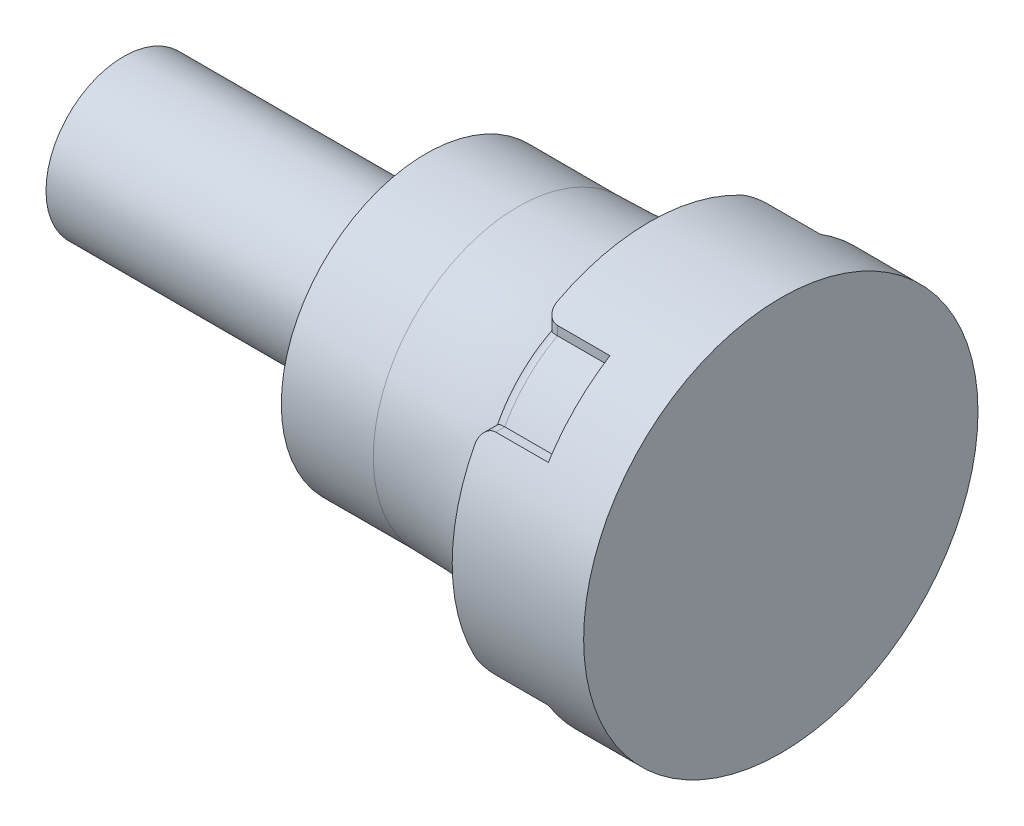
from build123d import *

# Parameters (mm, degrees)
BASPROSKE_W             = 10
BASPROSKE_H             = 134
TOOTHCUT_DEPTH          = 190.768279752
TEETHCUTS_COUNT         = 65
TEETHCUTS_ANGLE         = 354.461538462
HUBNEAONESKE_R          = 6
HUBNEARONE_DEPTH        = 40.0000508
BORSKE_R                = 4
BORE_DEPTH              = 50.0000508
ENL_V_MAT_EXTRU_1_DEPTH = 10
ENL_V_MAT_EXTRU_2_DEPTH = 5
CONG_1_R                = 10
CONG_2_R                = 2
ENL_V_MAT_EXTRU_3_DEPTH = 194.670907796
CONG_3_R                = 10
CONG_4_R                = 2
CONG_5_R                = 1
ESQUISSE5_R             = 11
ESQUISSE5_R_2           = 6
BOSS_EXTRU_1_DEPTH      = 17
CONG_6_SIZE             = 2
CONG_6_SIZE_2           = 10
BOSS_EXTRU_2_START      = -30
BOSS_EXTRU_2_DEPTH      = 30
BOSS_EXTRU_3_START      = 20.0000508
ESQUISSE7_R             = 4
BOSS_EXTRU_3_DEPTH      = 20.0000508
ENL_V_START             = -23
ESQUISSE8_R             = 6
ESQUISSE8_R_2           = 5.9
ENL_V_MAT_EXTRU_4_DEPTH = 23
ESQUISSE9_R             = 170.665852753
ESQUISSE9_R_2           = 15
ENL_V_MAT_EXTRU_8_DEPTH = 192.855196601


with BuildPart() as part:
    # BasProSke → Base-Revolve (revolve)
    with BuildSketch(Plane(origin=(0, 0, 0), x_dir=(1, 0, 0), z_dir=(0, 1, 0)), mode=Mode.PRIVATE) as base_revolve_sk:
        with Locations((5, 67)):
            Rectangle(BASPROSKE_W, BASPROSKE_H)
    revolve(base_revolve_sk.sketch.rotate(Axis((-10, 0, 0), (1, 0, 0)), 180), axis=Axis((-10, 0, 0), (1, 0, 0)))

    # TooCutSke → ToothCut (cut, through all)
    with BuildSketch(Plane(origin=(0, 0, 0), x_dir=(0, 0, -1), z_dir=(1, 0, 0))):
        with BuildLine():
            ThreePointArc((1.667679112, 124.987874801), (0, 124.999), (-1.667679112, 124.987874801))
            ThreePointArc((-1.667679112, 124.987874801), (-3.198590853, 129.537570146), (-5.142534786, 133.926704511))
            ThreePointArc((-5.142534786, 133.926704511), (0, 134.0254), (5.142534786, 133.926704511))
            ThreePointArc((5.142534786, 133.926704511), (3.198590853, 129.537570146), (1.667679112, 124.987874801))
        make_face()
    toothcut = extrude(amount=TOOTHCUT_DEPTH, mode=Mode.SUBTRACT)

    # TeethCuts: ToothCut ×65 about axis
    teethcuts_axis = Axis((-10, 0, 0), (1, 0, 0))
    for i in range(1, TEETHCUTS_COUNT):
        add(toothcut.rotate(teethcuts_axis, i * TEETHCUTS_ANGLE / (TEETHCUTS_COUNT - 1)), mode=Mode.SUBTRACT)

    # HubNeaOneSke → HubNearOne (add)
    with BuildSketch(Plane.ZY):
        with Locations(Location((0, 0, 0), (0, 0, 180))):
            Circle(HUBNEAONESKE_R)
    extrude(amount=HUBNEARONE_DEPTH)

    # BorSke → Bore (cut, symmetric)
    with BuildSketch(Plane(origin=(0, 0, 0), x_dir=(0, 0, -1), z_dir=(1, 0, 0))):
        with Locations(Location((0, 0, 0), (0, 0, 180))):
            Circle(BORSKE_R)
    extrude(amount=BORE_DEPTH, both=True, mode=Mode.SUBTRACT)

    # Esquisse1 → Enlèv. mat.-Extru.1 (cut)
    with BuildSketch(Plane(origin=(10, 0, 0), x_dir=(0, 0, -1), z_dir=(1, 0, 0))):
        with BuildLine():
            Line((3, 100), (3, 25))
            Line((3, 25), (-3, 25))
            Line((-3, 25), (-3, 100))
            ThreePointArc((-3, 100), (0, 103), (3, 100))
        make_face()
        with BuildLine():
            Line((-3, 25), (3, 25))
            ThreePointArc((3, 25), (0, 22), (-3, 25))
        make_face()
        with BuildLine():
            Line((100, 3), (25, 3))
            ThreePointArc((25, 3), (22, 0), (25, -3))
            Line((25, -3), (100, -3))
            ThreePointArc((100, -3), (103, 0), (100, 3))
        make_face()
        with BuildLine():
            Line((-100, -3), (-25, -3))
            ThreePointArc((-25, -3), (-22, 0), (-25, 3))
            Line((-25, 3), (-100, 3))
            ThreePointArc((-100, 3), (-103, 0), (-100, -3))
        make_face()
        with BuildLine():
            Line((3, -100), (3, -25))
            ThreePointArc((3, -25), (0, -22), (-3, -25))
            Line((-3, -25), (-3, -100))
            ThreePointArc((-3, -100), (0, -103), (3, -100))
        make_face()
    extrude(amount=-ENL_V_MAT_EXTRU_1_DEPTH, mode=Mode.SUBTRACT)

    # Esquisse3 → Enlèv. mat.-Extru.2 (cut)
    with BuildSketch(Plane.ZY):
        Polygon((-113, -8), (-113, -18), (-18, -18), (-18, -113), (-8, -113), (-8, -12), (-12, -12), (-12, -8), align=None)
        Polygon((-113, 8), (-12, 8), (-12, 12), (-8, 12), (-8, 113), (-18, 113), (-18, 18), (-113, 18), align=None)
        Polygon((8, 113), (8, 12), (12, 12), (12, 8), (113, 8), (113, 18), (18, 18), (18, 113), align=None)
        Polygon((113, -8), (12, -8), (12, -12), (8, -12), (8, -113), (18, -113), (18, -18), (113, -18), align=None)
    extrude(amount=-ENL_V_MAT_EXTRU_2_DEPTH, mode=Mode.SUBTRACT)

    # Congé1
    # the kernel refuses this fillet: 10 mm, written as the material it takes off along each edge
    with BuildSketch(Plane(origin=(-25, -18, -18), x_dir=(0, 0, -1), z_dir=(1, 0, 0)), Plane(origin=(-25, 18, -18), x_dir=(0, 1, 0), z_dir=(1, 0, 0)), Plane(origin=(-25, 18, 18), x_dir=(0, 0, 1), z_dir=(1, 0, 0)), Plane(origin=(-25, -18, 18), x_dir=(0, -1, 0), z_dir=(1, 0, 0))) as cong_1_piece_1:
        with BuildLine():
            CenterArc((CONG_1_R, -CONG_1_R), CONG_1_R, 90, 90)
            Line((0, -CONG_1_R), (0, 0))
            Line((0, 0), (CONG_1_R, 0))
        make_face()
    extrude(amount=30, mode=Mode.SUBTRACT)
    with BuildSketch(Plane(origin=(-10, -12, 12), x_dir=(0, 1, 0), z_dir=(1, 0, 0)), Plane(origin=(-10, -12, -12), x_dir=(0, 0, 1), z_dir=(1, 0, 0)), Plane(origin=(-10, 12, 12), x_dir=(0, 0, -1), z_dir=(1, 0, 0)), Plane(origin=(-10, 12, -12), x_dir=(0, -1, 0), z_dir=(1, 0, 0))) as cong_1_piece_2:
        with BuildLine():
            CenterArc((8.782329983, -8.782329983), CONG_1_R, 118.570059811, 32.859880379)
            Line((0, -4), (0, 0))
            Line((0, 0), (4, 0))
        make_face()
    extrude(amount=15, mode=Mode.SUBTRACT)

    # Congé2
    cong_2_edges = [part.edges().sort_by_distance(p)[0] for p in [
        (2.5, 18, 113),
        (2.5, 8, 113),
        (2.5, 113, 8),
        (2.5, 113, 18),
        (2.5, 8, -113),
        (2.5, 18, -113),
        (2.5, 113, -18),
        (2.5, 113, -8),
        (2.5, -8, -113),
        (2.5, -113, -8),
        (2.5, -113, -18),
        (2.5, -18, -113),
        (2.5, -113, 18),
        (2.5, -113, 8),
        (2.5, -8, 113),
        (2.5, -18, 113),
    ]]
    fillet(cong_2_edges, radius=CONG_2_R)

    # Esquisse4 → Enlèv. mat.-Extru.3 (cut, through all)
    with BuildSketch(Plane.ZY):
        with BuildLine():
            Line((-93.541434669, 35.355339059), (-35.355339059, 35.355339059))
            Line((-35.355339059, 35.355339059), (-35.355339059, 93.541434669))
            ThreePointArc((-35.355339059, 93.541434669), (-70.710678119, 70.710678119), (-93.541434669, 35.355339059))
        make_face()
        with BuildLine():
            Line((35.355339059, 93.541434669), (35.355339059, 35.355339059))
            Line((35.355339059, 35.355339059), (93.541434669, 35.355339059))
            ThreePointArc((93.541434669, 35.355339059), (70.710678119, 70.710678119), (35.355339059, 93.541434669))
        make_face()
        with BuildLine():
            Line((93.541434669, -35.355339059), (35.355339059, -35.355339059))
            Line((35.355339059, -35.355339059), (35.355339059, -93.541434669))
            ThreePointArc((35.355339059, -93.541434669), (70.710678119, -70.710678119), (93.541434669, -35.355339059))
        make_face()
        with BuildLine():
            Line((-35.355339059, -93.541434669), (-35.355339059, -35.355339059))
            Line((-35.355339059, -35.355339059), (-93.541434669, -35.355339059))
            ThreePointArc((-93.541434669, -35.355339059), (-70.710678119, -70.710678119), (-35.355339059, -93.541434669))
        make_face()
    extrude(amount=-ENL_V_MAT_EXTRU_3_DEPTH, mode=Mode.SUBTRACT)

    # Congé3
    cong_3_edges = [part.edges().sort_by_distance(p)[0] for p in [
        (5, 35.355339059, -35.355339059),
        (5, 35.355339059, 35.355339059),
        (5, -35.355339059, 35.355339059),
        (5, -35.355339059, -35.355339059),
    ]]
    fillet(cong_3_edges, radius=CONG_3_R)

    # Congé4
    cong_4_edges = [part.edges().sort_by_distance(p)[0] for p in [
        (5, 35.355339059, -93.541434669),
        (5, 93.541434669, -35.355339059),
        (5, 93.541434669, 35.355339059),
        (5, 35.355339059, 93.541434669),
        (5, -35.355339059, 93.541434669),
        (5, -93.541434669, 35.355339059),
        (5, -93.541434669, -35.355339059),
        (5, -35.355339059, -93.541434669),
    ]]
    fillet(cong_4_edges, radius=CONG_4_R)

    # Congé5
    # the kernel refuses this fillet: 1 mm, written as the material it takes off along each edge
    with BuildSketch(Plane(origin=(0, 8, 9.5), x_dir=(0, -1, 0), z_dir=(0, 0, 1))) as cong_5_piece_1_section:
        with BuildLine():
            CenterArc((CONG_5_R, CONG_5_R), CONG_5_R, 180, 90)
            Line((0, CONG_5_R), (0, 0))
            Line((0, 0), (CONG_5_R, 0))
        make_face()
    cong_5_piece_1 = extrude(amount=101.5, mode=Mode.PRIVATE)
    cong_5_piece_1 = cong_5_piece_1 - Plane(origin=(0, 3.217670017, 3.217670017), x_dir=(0, 0, -1), z_dir=(-1, 0, 0)) * Cylinder(10, 208, mode=Mode.PRIVATE)
    with BuildSketch(Plane(origin=(0, 9.5, -8), x_dir=(0, 0, 1), z_dir=(0, 1, 0))) as cong_5_piece_2_section:
        with BuildLine():
            CenterArc((CONG_5_R, CONG_5_R), CONG_5_R, 180, 90)
            Line((0, CONG_5_R), (0, 0))
            Line((0, 0), (CONG_5_R, 0))
        make_face()
    cong_5_piece_2 = extrude(amount=101.5, mode=Mode.PRIVATE)
    cong_5_piece_2 = cong_5_piece_2 - Plane(origin=(0, 3.217670017, -3.217670017), x_dir=(0, -1, 0), z_dir=(-1, 0, 0)) * Cylinder(10, 207, mode=Mode.PRIVATE)
    with BuildSketch(Plane(origin=(0, -8, -9.5), x_dir=(0, 1, 0), z_dir=(0, 0, -1))) as cong_5_piece_3_section:
        with BuildLine():
            CenterArc((CONG_5_R, CONG_5_R), CONG_5_R, 180, 90)
            Line((0, CONG_5_R), (0, 0))
            Line((0, 0), (CONG_5_R, 0))
        make_face()
    cong_5_piece_3 = extrude(amount=101.5, mode=Mode.PRIVATE)
    cong_5_piece_3 = cong_5_piece_3 - Plane(origin=(0, -3.217670017, -3.217670017), x_dir=(0, 0, 1), z_dir=(-1, 0, 0)) * Cylinder(10, 207, mode=Mode.PRIVATE)
    with BuildSketch(Plane(origin=(0, -9.5, 8), x_dir=(0, 0, -1), z_dir=(0, -1, 0))) as cong_5_piece_4_section:
        with BuildLine():
            CenterArc((CONG_5_R, CONG_5_R), CONG_5_R, 180, 90)
            Line((0, CONG_5_R), (0, 0))
            Line((0, 0), (CONG_5_R, 0))
        make_face()
    cong_5_piece_4 = extrude(amount=101.5, mode=Mode.PRIVATE)
    cong_5_piece_4 = cong_5_piece_4 - Plane(origin=(0, -3.217670017, 3.217670017), x_dir=(0, 1, 0), z_dir=(-1, 0, 0)) * Cylinder(10, 207, mode=Mode.PRIVATE)
    with BuildSketch(Plane(origin=(0, -28, -18), x_dir=(0, 0, -1), z_dir=(0, -1, 0)), Plane(origin=(0, 18, -28), x_dir=(0, 1, 0), z_dir=(0, 0, -1)), Plane(origin=(0, -18, 28), x_dir=(0, -1, 0), z_dir=(0, 0, 1)), Plane(origin=(0, 28, 18), x_dir=(0, 0, 1), z_dir=(0, 1, 0)), Plane(origin=(0, 111, -18), x_dir=(0, 0, -1), z_dir=(0, -1, 0)), Plane(origin=(0, 18, 111), x_dir=(0, 1, 0), z_dir=(0, 0, -1)), Plane(origin=(0, -111, 18), x_dir=(0, 0, 1), z_dir=(0, 1, 0)), Plane(origin=(0, -18, -111), x_dir=(0, -1, 0), z_dir=(0, 0, 1))) as cong_5_piece_5:
        with BuildLine():
            CenterArc((CONG_5_R, CONG_5_R), CONG_5_R, 180, 90)
            Line((0, CONG_5_R), (0, 0))
            Line((0, 0), (CONG_5_R, 0))
        make_face()
    cong_5_piece_5_solid = extrude(amount=83, mode=Mode.PRIVATE)
    with BuildSketch(Plane(origin=(0, 3.217670017, -3.217670017), x_dir=(0, 0.9692508920434058, -0.24607459900010414), z_dir=(0, 0.24607459900010414, 0.9692508920434058))) as cong_5_piece_6_section:
        with BuildLine():
            CenterArc((10 - CONG_5_R, -CONG_5_R), CONG_5_R, 0, 90)
            Line((10, -CONG_5_R), (10, 0))
            Line((10, 0), (10 - CONG_5_R, 0))
        make_face()
    cong_5_piece_6 = revolve(axis=Axis((0, 3.217670017, -3.217670017), (-1, 0, 0)), revolution_arc=61.509303849, mode=Mode.PRIVATE)
    cong_5_piece_6 = split(cong_5_piece_6, bisect_by=Plane(origin=(0, 8, -3.217670017), z_dir=(0, 1, 0)), keep=Keep.TOP, mode=Mode.PRIVATE)
    cong_5_piece_6 = split(cong_5_piece_6, bisect_by=Plane(origin=(0, 3.217670017, -8), z_dir=(0, 0, -1)), keep=Keep.TOP, mode=Mode.PRIVATE)
    with BuildSketch(Plane(origin=(0, 3.217670017, 3.217670017), x_dir=(0, 0.24607459900010414, 0.9692508920434058), z_dir=(0, -0.9692508920434058, 0.24607459900010414))) as cong_5_piece_7_section:
        with BuildLine():
            CenterArc((10 - CONG_5_R, -CONG_5_R), CONG_5_R, 0, 90)
            Line((10, -CONG_5_R), (10, 0))
            Line((10, 0), (10 - CONG_5_R, 0))
        make_face()
    cong_5_piece_7 = revolve(axis=Axis((0, 3.217670017, 3.217670017), (-1, 0, 0)), revolution_arc=61.509303849, mode=Mode.PRIVATE)
    cong_5_piece_7 = split(cong_5_piece_7, bisect_by=Plane(origin=(0, 3.217670017, 8), z_dir=(0, 0, 1)), keep=Keep.TOP, mode=Mode.PRIVATE)
    cong_5_piece_7 = split(cong_5_piece_7, bisect_by=Plane(origin=(0, 8, 3.217670017), z_dir=(0, 1, 0)), keep=Keep.TOP, mode=Mode.PRIVATE)
    with BuildSketch(Plane(origin=(0, -3.217670017, -3.217670017), x_dir=(0, -0.24607459900010414, -0.9692508920434058), z_dir=(0, 0.9692508920434058, -0.24607459900010414))) as cong_5_piece_8_section:
        with BuildLine():
            CenterArc((10 - CONG_5_R, -CONG_5_R), CONG_5_R, 0, 90)
            Line((10, -CONG_5_R), (10, 0))
            Line((10, 0), (10 - CONG_5_R, 0))
        make_face()
    cong_5_piece_8 = revolve(axis=Axis((0, -3.217670017, -3.217670017), (-1, 0, 0)), revolution_arc=61.509303849, mode=Mode.PRIVATE)
    cong_5_piece_8 = split(cong_5_piece_8, bisect_by=Plane(origin=(0, -8, -3.217670017), z_dir=(0, -1, 0)), keep=Keep.TOP, mode=Mode.PRIVATE)
    cong_5_piece_8 = split(cong_5_piece_8, bisect_by=Plane(origin=(0, -3.217670017, -8), z_dir=(0, 0, -1)), keep=Keep.TOP, mode=Mode.PRIVATE)
    with BuildSketch(Plane(origin=(0, -3.217670017, 3.217670017), x_dir=(0, -0.9692508920434058, 0.24607459900010414), z_dir=(0, -0.24607459900010414, -0.9692508920434058))) as cong_5_piece_9_section:
        with BuildLine():
            CenterArc((10 - CONG_5_R, -CONG_5_R), CONG_5_R, 0, 90)
            Line((10, -CONG_5_R), (10, 0))
            Line((10, 0), (10 - CONG_5_R, 0))
        make_face()
    cong_5_piece_9 = revolve(axis=Axis((0, -3.217670017, 3.217670017), (-1, 0, 0)), revolution_arc=61.509303849, mode=Mode.PRIVATE)
    cong_5_piece_9 = split(cong_5_piece_9, bisect_by=Plane(origin=(0, -8, 3.217670017), z_dir=(0, -1, 0)), keep=Keep.TOP, mode=Mode.PRIVATE)
    cong_5_piece_9 = split(cong_5_piece_9, bisect_by=Plane(origin=(0, -3.217670017, 8), z_dir=(0, 0, 1)), keep=Keep.TOP, mode=Mode.PRIVATE)
    with BuildSketch(Plane(origin=(0, -28, 28), x_dir=(0, 1, 0), z_dir=(0, 0, 1))) as cong_5_piece_10:
        with BuildLine():
            CenterArc((10 - CONG_5_R, -CONG_5_R), CONG_5_R, 0, 90)
            Line((10, -CONG_5_R), (10, 0))
            Line((10, 0), (10 - CONG_5_R, 0))
        make_face()
    cong_5_piece_10_solid = revolve(axis=Axis((0, -28, 28), (-1, 0, 0)), revolution_arc=90, mode=Mode.PRIVATE)
    with BuildSketch(Plane(origin=(0, 28, 28), x_dir=(0, 0, -1), z_dir=(0, 1, 0))) as cong_5_piece_11:
        with BuildLine():
            CenterArc((10 - CONG_5_R, -CONG_5_R), CONG_5_R, 0, 90)
            Line((10, -CONG_5_R), (10, 0))
            Line((10, 0), (10 - CONG_5_R, 0))
        make_face()
    cong_5_piece_11_solid = revolve(axis=Axis((0, 28, 28), (-1, 0, 0)), revolution_arc=90, mode=Mode.PRIVATE)
    with BuildSketch(Plane(origin=(0, 28, -28), x_dir=(0, -1, 0), z_dir=(0, 0, -1))) as cong_5_piece_12:
        with BuildLine():
            CenterArc((10 - CONG_5_R, -CONG_5_R), CONG_5_R, 0, 90)
            Line((10, -CONG_5_R), (10, 0))
            Line((10, 0), (10 - CONG_5_R, 0))
        make_face()
    cong_5_piece_12_solid = revolve(axis=Axis((0, 28, -28), (-1, 0, 0)), revolution_arc=90, mode=Mode.PRIVATE)
    with BuildSketch(Plane(origin=(0, -28, -28), x_dir=(0, 0, 1), z_dir=(0, -1, 0))) as cong_5_piece_13:
        with BuildLine():
            CenterArc((10 - CONG_5_R, -CONG_5_R), CONG_5_R, 0, 90)
            Line((10, -CONG_5_R), (10, 0))
            Line((10, 0), (10 - CONG_5_R, 0))
        make_face()
    cong_5_piece_13_solid = revolve(axis=Axis((0, -28, -28), (-1, 0, 0)), revolution_arc=90, mode=Mode.PRIVATE)
    with BuildSketch(Plane(origin=(0, 113, -10), x_dir=(0, 1, 0), z_dir=(0, 0, -1)), Plane(origin=(0, 113, 16), x_dir=(0, 1, 0), z_dir=(0, 0, -1)), Plane(origin=(0, 10, 113), x_dir=(0, 0, 1), z_dir=(0, 1, 0)), Plane(origin=(0, -16, 113), x_dir=(0, 0, 1), z_dir=(0, 1, 0)), Plane(origin=(0, -113, 10), x_dir=(0, -1, 0), z_dir=(0, 0, 1)), Plane(origin=(0, -113, -16), x_dir=(0, -1, 0), z_dir=(0, 0, 1)), Plane(origin=(0, -10, -113), x_dir=(0, 0, -1), z_dir=(0, -1, 0)), Plane(origin=(0, 16, -113), x_dir=(0, 0, -1), z_dir=(0, -1, 0))) as cong_5_piece_14:
        with BuildLine():
            CenterArc((CONG_5_R, CONG_5_R), CONG_5_R, 180, 90)
            Line((0, CONG_5_R), (0, 0))
            Line((0, 0), (CONG_5_R, 0))
        make_face()
    cong_5_piece_14_solid = extrude(amount=6, mode=Mode.PRIVATE)
    with BuildSketch(Plane(origin=(0, 111, 8), x_dir=(0, 0, -1), z_dir=(0, -1, 0))) as cong_5_piece_15_section:
        with BuildLine():
            CenterArc((CONG_5_R, CONG_5_R), CONG_5_R, 180, 90)
            Line((0, CONG_5_R), (0, 0))
            Line((0, 0), (CONG_5_R, 0))
        make_face()
    cong_5_piece_15 = extrude(amount=101.5, mode=Mode.PRIVATE)
    cong_5_piece_15 = cong_5_piece_15 - Plane(origin=(0, 3.217670017, 3.217670017), x_dir=(0, 0, -1), z_dir=(-1, 0, 0)) * Cylinder(10, 207, mode=Mode.PRIVATE)
    with BuildSketch(Plane(origin=(0, -8, 111), x_dir=(0, 1, 0), z_dir=(0, 0, -1))) as cong_5_piece_16_section:
        with BuildLine():
            CenterArc((CONG_5_R, CONG_5_R), CONG_5_R, 180, 90)
            Line((0, CONG_5_R), (0, 0))
            Line((0, 0), (CONG_5_R, 0))
        make_face()
    cong_5_piece_16 = extrude(amount=101.5, mode=Mode.PRIVATE)
    cong_5_piece_16 = cong_5_piece_16 - Plane(origin=(0, -3.217670017, 3.217670017), x_dir=(0, 1, 0), z_dir=(-1, 0, 0)) * Cylinder(10, 207, mode=Mode.PRIVATE)
    with BuildSketch(Plane(origin=(0, -111, -8), x_dir=(0, 0, 1), z_dir=(0, 1, 0))) as cong_5_piece_17_section:
        with BuildLine():
            CenterArc((CONG_5_R, CONG_5_R), CONG_5_R, 180, 90)
            Line((0, CONG_5_R), (0, 0))
            Line((0, 0), (CONG_5_R, 0))
        make_face()
    cong_5_piece_17 = extrude(amount=101.5, mode=Mode.PRIVATE)
    cong_5_piece_17 = cong_5_piece_17 - Plane(origin=(0, -3.217670017, -3.217670017), x_dir=(0, 0, 1), z_dir=(-1, 0, 0)) * Cylinder(10, 207, mode=Mode.PRIVATE)
    with BuildSketch(Plane(origin=(0, 8, -111), x_dir=(0, -1, 0), z_dir=(0, 0, 1))) as cong_5_piece_18_section:
        with BuildLine():
            CenterArc((CONG_5_R, CONG_5_R), CONG_5_R, 180, 90)
            Line((0, CONG_5_R), (0, 0))
            Line((0, 0), (CONG_5_R, 0))
        make_face()
    cong_5_piece_18 = extrude(amount=101.5, mode=Mode.PRIVATE)
    cong_5_piece_18 = cong_5_piece_18 - Plane(origin=(0, 3.217670017, -3.217670017), x_dir=(0, -1, 0), z_dir=(-1, 0, 0)) * Cylinder(10, 207, mode=Mode.PRIVATE)
    with BuildSketch(Plane(origin=(0, 111, -16), x_dir=(0, 1, 0), z_dir=(0, 0, 1))) as cong_5_piece_19:
        with BuildLine():
            CenterArc((2 + CONG_5_R, -CONG_5_R), CONG_5_R, 90, 90)
            Line((2, -CONG_5_R), (2, 0))
            Line((2, 0), (2 + CONG_5_R, 0))
        make_face()
    cong_5_piece_19_solid = revolve(axis=Axis((0, 111, -16), (-1, 0, 0)), revolution_arc=90, mode=Mode.PRIVATE)
    with BuildSketch(Plane(origin=(0, 111, -10), x_dir=(0, 0, 1), z_dir=(0, -1, 0))) as cong_5_piece_20:
        with BuildLine():
            CenterArc((2 + CONG_5_R, -CONG_5_R), CONG_5_R, 90, 90)
            Line((2, -CONG_5_R), (2, 0))
            Line((2, 0), (2 + CONG_5_R, 0))
        make_face()
    cong_5_piece_20_solid = revolve(axis=Axis((0, 111, -10), (-1, 0, 0)), revolution_arc=90, mode=Mode.PRIVATE)
    with BuildSketch(Plane(origin=(0, 111, 10), x_dir=(0, 0, -1), z_dir=(0, -1, 0))) as cong_5_piece_21:
        with BuildLine():
            CenterArc((2 + CONG_5_R, CONG_5_R), CONG_5_R, 180, 90)
            Line((2, CONG_5_R), (2, 0))
            Line((2, 0), (2 + CONG_5_R, 0))
        make_face()
    cong_5_piece_21_solid = revolve(axis=Axis((0, 111, 10), (1, 0, 0)), revolution_arc=90, mode=Mode.PRIVATE)
    with BuildSketch(Plane(origin=(0, 111, 16), x_dir=(0, 0, 1), z_dir=(0, -1, 0))) as cong_5_piece_22:
        with BuildLine():
            CenterArc((2 + CONG_5_R, -CONG_5_R), CONG_5_R, 90, 90)
            Line((2, -CONG_5_R), (2, 0))
            Line((2, 0), (2 + CONG_5_R, 0))
        make_face()
    cong_5_piece_22_solid = revolve(axis=Axis((0, 111, 16), (-1, 0, 0)), revolution_arc=90, mode=Mode.PRIVATE)
    with BuildSketch(Plane(origin=(0, 16, 111), x_dir=(0, 0, 1), z_dir=(0, -1, 0))) as cong_5_piece_23:
        with BuildLine():
            CenterArc((2 + CONG_5_R, -CONG_5_R), CONG_5_R, 90, 90)
            Line((2, -CONG_5_R), (2, 0))
            Line((2, 0), (2 + CONG_5_R, 0))
        make_face()
    cong_5_piece_23_solid = revolve(axis=Axis((0, 16, 111), (-1, 0, 0)), revolution_arc=90, mode=Mode.PRIVATE)
    with BuildSketch(Plane(origin=(0, 10, 111), x_dir=(0, -1, 0), z_dir=(0, 0, -1))) as cong_5_piece_24:
        with BuildLine():
            CenterArc((2 + CONG_5_R, -CONG_5_R), CONG_5_R, 90, 90)
            Line((2, -CONG_5_R), (2, 0))
            Line((2, 0), (2 + CONG_5_R, 0))
        make_face()
    cong_5_piece_24_solid = revolve(axis=Axis((0, 10, 111), (-1, 0, 0)), revolution_arc=90, mode=Mode.PRIVATE)
    with BuildSketch(Plane(origin=(0, -10, 111), x_dir=(0, 1, 0), z_dir=(0, 0, -1))) as cong_5_piece_25:
        with BuildLine():
            CenterArc((2 + CONG_5_R, CONG_5_R), CONG_5_R, 180, 90)
            Line((2, CONG_5_R), (2, 0))
            Line((2, 0), (2 + CONG_5_R, 0))
        make_face()
    cong_5_piece_25_solid = revolve(axis=Axis((0, -10, 111), (1, 0, 0)), revolution_arc=90, mode=Mode.PRIVATE)
    with BuildSketch(Plane(origin=(0, -16, 111), x_dir=(0, -1, 0), z_dir=(0, 0, -1))) as cong_5_piece_26:
        with BuildLine():
            CenterArc((2 + CONG_5_R, -CONG_5_R), CONG_5_R, 90, 90)
            Line((2, -CONG_5_R), (2, 0))
            Line((2, 0), (2 + CONG_5_R, 0))
        make_face()
    cong_5_piece_26_solid = revolve(axis=Axis((0, -16, 111), (-1, 0, 0)), revolution_arc=90, mode=Mode.PRIVATE)
    with BuildSketch(Plane(origin=(0, -111, 16), x_dir=(0, -1, 0), z_dir=(0, 0, -1))) as cong_5_piece_27:
        with BuildLine():
            CenterArc((2 + CONG_5_R, -CONG_5_R), CONG_5_R, 90, 90)
            Line((2, -CONG_5_R), (2, 0))
            Line((2, 0), (2 + CONG_5_R, 0))
        make_face()
    cong_5_piece_27_solid = revolve(axis=Axis((0, -111, 16), (-1, 0, 0)), revolution_arc=90, mode=Mode.PRIVATE)
    with BuildSketch(Plane(origin=(0, -111, 10), x_dir=(0, 0, -1), z_dir=(0, 1, 0))) as cong_5_piece_28:
        with BuildLine():
            CenterArc((2 + CONG_5_R, -CONG_5_R), CONG_5_R, 90, 90)
            Line((2, -CONG_5_R), (2, 0))
            Line((2, 0), (2 + CONG_5_R, 0))
        make_face()
    cong_5_piece_28_solid = revolve(axis=Axis((0, -111, 10), (-1, 0, 0)), revolution_arc=90, mode=Mode.PRIVATE)
    with BuildSketch(Plane(origin=(0, -111, -10), x_dir=(0, -1, 0), z_dir=(0, 0, -1))) as cong_5_piece_29:
        with BuildLine():
            CenterArc((2 + CONG_5_R, -CONG_5_R), CONG_5_R, 90, 90)
            Line((2, -CONG_5_R), (2, 0))
            Line((2, 0), (2 + CONG_5_R, 0))
        make_face()
    cong_5_piece_29_solid = revolve(axis=Axis((0, -111, -10), (-1, 0, 0)), revolution_arc=90, mode=Mode.PRIVATE)
    with BuildSketch(Plane(origin=(0, -111, -16), x_dir=(0, 0, -1), z_dir=(0, 1, 0))) as cong_5_piece_30:
        with BuildLine():
            CenterArc((2 + CONG_5_R, -CONG_5_R), CONG_5_R, 90, 90)
            Line((2, -CONG_5_R), (2, 0))
            Line((2, 0), (2 + CONG_5_R, 0))
        make_face()
    cong_5_piece_30_solid = revolve(axis=Axis((0, -111, -16), (-1, 0, 0)), revolution_arc=90, mode=Mode.PRIVATE)
    with BuildSketch(Plane(origin=(0, -16, -111), x_dir=(0, 0, -1), z_dir=(0, 1, 0))) as cong_5_piece_31:
        with BuildLine():
            CenterArc((2 + CONG_5_R, -CONG_5_R), CONG_5_R, 90, 90)
            Line((2, -CONG_5_R), (2, 0))
            Line((2, 0), (2 + CONG_5_R, 0))
        make_face()
    cong_5_piece_31_solid = revolve(axis=Axis((0, -16, -111), (-1, 0, 0)), revolution_arc=90, mode=Mode.PRIVATE)
    with BuildSketch(Plane(origin=(0, -10, -111), x_dir=(0, 0, -1), z_dir=(0, -1, 0))) as cong_5_piece_32:
        with BuildLine():
            CenterArc((2 + CONG_5_R, CONG_5_R), CONG_5_R, 180, 90)
            Line((2, CONG_5_R), (2, 0))
            Line((2, 0), (2 + CONG_5_R, 0))
        make_face()
    cong_5_piece_32_solid = revolve(axis=Axis((0, -10, -111), (1, 0, 0)), revolution_arc=90, mode=Mode.PRIVATE)
    with BuildSketch(Plane(origin=(0, 10, -111), x_dir=(0, -1, 0), z_dir=(0, 0, 1))) as cong_5_piece_33:
        with BuildLine():
            CenterArc((2 + CONG_5_R, CONG_5_R), CONG_5_R, 180, 90)
            Line((2, CONG_5_R), (2, 0))
            Line((2, 0), (2 + CONG_5_R, 0))
        make_face()
    cong_5_piece_33_solid = revolve(axis=Axis((0, 10, -111), (1, 0, 0)), revolution_arc=90, mode=Mode.PRIVATE)
    with BuildSketch(Plane(origin=(0, 16, -111), x_dir=(0, 1, 0), z_dir=(0, 0, 1))) as cong_5_piece_34:
        with BuildLine():
            CenterArc((2 + CONG_5_R, -CONG_5_R), CONG_5_R, 90, 90)
            Line((2, -CONG_5_R), (2, 0))
            Line((2, 0), (2 + CONG_5_R, 0))
        make_face()
    cong_5_piece_34_solid = revolve(axis=Axis((0, 16, -111), (-1, 0, 0)), revolution_arc=90, mode=Mode.PRIVATE)
    with BuildSketch(Plane(origin=(0, 3.217670017, 3.217670017), x_dir=(0, 0.24607459900010414, 0.9692508920434058), z_dir=(0, -0.9692508920434058, 0.24607459900010414))) as cong_5_piece_35a_section:
        with BuildLine():
            CenterArc((10 - CONG_5_R, -CONG_5_R), CONG_5_R, 0, 90)
            Line((10, -CONG_5_R), (10, 0))
            Line((10, 0), (10 - CONG_5_R, 0))
        make_face()
    cong_5_piece_35a = revolve(axis=Axis((0, 3.217670017, 3.217670017), (-1, 0, 0)), revolution_arc=61.509303849, mode=Mode.PRIVATE)
    cong_5_piece_35a = split(cong_5_piece_35a, bisect_by=Plane(origin=(0, 8, 3.217670017), z_dir=(0, -1, 0)), keep=Keep.TOP, mode=Mode.PRIVATE)
    with BuildSketch(Plane(origin=(0, 8, 9.5), x_dir=(0, -1, 0), z_dir=(0, 0, 1))) as cong_5_piece_35b_section:
        with BuildLine():
            CenterArc((CONG_5_R, CONG_5_R), CONG_5_R, 180, 90)
            Line((0, CONG_5_R), (0, 0))
            Line((0, 0), (CONG_5_R, 0))
        make_face()
    cong_5_piece_35b = extrude(amount=101.5, mode=Mode.PRIVATE)
    cong_5_piece_35b = cong_5_piece_35b & Plane(origin=(0, 3.217670017, 3.217670017), x_dir=(0, 0, -1), z_dir=(-1, 0, 0)) * Cylinder(10, 208, mode=Mode.PRIVATE)
    cong_5_piece_35 = cong_5_piece_35a & cong_5_piece_35b
    with BuildSketch(Plane(origin=(0, 3.217670017, -3.217670017), x_dir=(0, 0.9692508920434058, -0.24607459900010414), z_dir=(0, 0.24607459900010414, 0.9692508920434058))) as cong_5_piece_36a_section:
        with BuildLine():
            CenterArc((10 - CONG_5_R, -CONG_5_R), CONG_5_R, 0, 90)
            Line((10, -CONG_5_R), (10, 0))
            Line((10, 0), (10 - CONG_5_R, 0))
        make_face()
    cong_5_piece_36a = revolve(axis=Axis((0, 3.217670017, -3.217670017), (-1, 0, 0)), revolution_arc=61.509303849, mode=Mode.PRIVATE)
    cong_5_piece_36a = split(cong_5_piece_36a, bisect_by=Plane(origin=(0, 3.217670017, -8), z_dir=(0, 0, 1)), keep=Keep.TOP, mode=Mode.PRIVATE)
    with BuildSketch(Plane(origin=(0, 9.5, -8), x_dir=(0, 0, 1), z_dir=(0, 1, 0))) as cong_5_piece_36b_section:
        with BuildLine():
            CenterArc((CONG_5_R, CONG_5_R), CONG_5_R, 180, 90)
            Line((0, CONG_5_R), (0, 0))
            Line((0, 0), (CONG_5_R, 0))
        make_face()
    cong_5_piece_36b = extrude(amount=101.5, mode=Mode.PRIVATE)
    cong_5_piece_36b = cong_5_piece_36b & Plane(origin=(0, 3.217670017, -3.217670017), x_dir=(0, -1, 0), z_dir=(-1, 0, 0)) * Cylinder(10, 207, mode=Mode.PRIVATE)
    cong_5_piece_36 = cong_5_piece_36a & cong_5_piece_36b
    with BuildSketch(Plane(origin=(0, -8, -9.5), x_dir=(0, 1, 0), z_dir=(0, 0, -1))) as cong_5_piece_37a_section:
        with BuildLine():
            CenterArc((CONG_5_R, CONG_5_R), CONG_5_R, 180, 90)
            Line((0, CONG_5_R), (0, 0))
            Line((0, 0), (CONG_5_R, 0))
        make_face()
    cong_5_piece_37a = extrude(amount=101.5, mode=Mode.PRIVATE)
    cong_5_piece_37a = cong_5_piece_37a & Plane(origin=(0, -3.217670017, -3.217670017), x_dir=(0, 0, 1), z_dir=(-1, 0, 0)) * Cylinder(10, 207, mode=Mode.PRIVATE)
    with BuildSketch(Plane(origin=(0, -3.217670017, -3.217670017), x_dir=(0, -0.24607459900010414, -0.9692508920434058), z_dir=(0, 0.9692508920434058, -0.24607459900010414))) as cong_5_piece_37b_section:
        with BuildLine():
            CenterArc((10 - CONG_5_R, -CONG_5_R), CONG_5_R, 0, 90)
            Line((10, -CONG_5_R), (10, 0))
            Line((10, 0), (10 - CONG_5_R, 0))
        make_face()
    cong_5_piece_37b = revolve(axis=Axis((0, -3.217670017, -3.217670017), (-1, 0, 0)), revolution_arc=61.509303849, mode=Mode.PRIVATE)
    cong_5_piece_37b = split(cong_5_piece_37b, bisect_by=Plane(origin=(0, -8, -3.217670017), z_dir=(0, 1, 0)), keep=Keep.TOP, mode=Mode.PRIVATE)
    cong_5_piece_37 = cong_5_piece_37a & cong_5_piece_37b
    with BuildSketch(Plane(origin=(0, -3.217670017, 3.217670017), x_dir=(0, -0.9692508920434058, 0.24607459900010414), z_dir=(0, -0.24607459900010414, -0.9692508920434058))) as cong_5_piece_38a_section:
        with BuildLine():
            CenterArc((10 - CONG_5_R, -CONG_5_R), CONG_5_R, 0, 90)
            Line((10, -CONG_5_R), (10, 0))
            Line((10, 0), (10 - CONG_5_R, 0))
        make_face()
    cong_5_piece_38a = revolve(axis=Axis((0, -3.217670017, 3.217670017), (-1, 0, 0)), revolution_arc=61.509303849, mode=Mode.PRIVATE)
    cong_5_piece_38a = split(cong_5_piece_38a, bisect_by=Plane(origin=(0, -3.217670017, 8), z_dir=(0, 0, -1)), keep=Keep.TOP, mode=Mode.PRIVATE)
    with BuildSketch(Plane(origin=(0, -9.5, 8), x_dir=(0, 0, -1), z_dir=(0, -1, 0))) as cong_5_piece_38b_section:
        with BuildLine():
            CenterArc((CONG_5_R, CONG_5_R), CONG_5_R, 180, 90)
            Line((0, CONG_5_R), (0, 0))
            Line((0, 0), (CONG_5_R, 0))
        make_face()
    cong_5_piece_38b = extrude(amount=101.5, mode=Mode.PRIVATE)
    cong_5_piece_38b = cong_5_piece_38b & Plane(origin=(0, -3.217670017, 3.217670017), x_dir=(0, 1, 0), z_dir=(-1, 0, 0)) * Cylinder(10, 207, mode=Mode.PRIVATE)
    cong_5_piece_38 = cong_5_piece_38a & cong_5_piece_38b
    with BuildSketch(Plane(origin=(0, 8, -111), x_dir=(0, -1, 0), z_dir=(0, 0, 1))) as cong_5_piece_39a_section:
        with BuildLine():
            CenterArc((CONG_5_R, CONG_5_R), CONG_5_R, 180, 90)
            Line((0, CONG_5_R), (0, 0))
            Line((0, 0), (CONG_5_R, 0))
        make_face()
    cong_5_piece_39a = extrude(amount=101.5, mode=Mode.PRIVATE)
    cong_5_piece_39a = cong_5_piece_39a & Plane(origin=(0, 3.217670017, -3.217670017), x_dir=(0, -1, 0), z_dir=(-1, 0, 0)) * Cylinder(10, 207, mode=Mode.PRIVATE)
    with BuildSketch(Plane(origin=(0, 3.217670017, -3.217670017), x_dir=(0, 0.9692508920434058, -0.24607459900010414), z_dir=(0, 0.24607459900010414, 0.9692508920434058))) as cong_5_piece_39b_section:
        with BuildLine():
            CenterArc((10 - CONG_5_R, -CONG_5_R), CONG_5_R, 0, 90)
            Line((10, -CONG_5_R), (10, 0))
            Line((10, 0), (10 - CONG_5_R, 0))
        make_face()
    cong_5_piece_39b = revolve(axis=Axis((0, 3.217670017, -3.217670017), (-1, 0, 0)), revolution_arc=61.509303849, mode=Mode.PRIVATE)
    cong_5_piece_39b = split(cong_5_piece_39b, bisect_by=Plane(origin=(0, 8, -3.217670017), z_dir=(0, -1, 0)), keep=Keep.TOP, mode=Mode.PRIVATE)
    cong_5_piece_39 = cong_5_piece_39a & cong_5_piece_39b
    with BuildSketch(Plane(origin=(0, 111, 8), x_dir=(0, 0, -1), z_dir=(0, -1, 0))) as cong_5_piece_40a_section:
        with BuildLine():
            CenterArc((CONG_5_R, CONG_5_R), CONG_5_R, 180, 90)
            Line((0, CONG_5_R), (0, 0))
            Line((0, 0), (CONG_5_R, 0))
        make_face()
    cong_5_piece_40a = extrude(amount=101.5, mode=Mode.PRIVATE)
    cong_5_piece_40a = cong_5_piece_40a & Plane(origin=(0, 3.217670017, 3.217670017), x_dir=(0, 0, -1), z_dir=(-1, 0, 0)) * Cylinder(10, 207, mode=Mode.PRIVATE)
    with BuildSketch(Plane(origin=(0, 3.217670017, 3.217670017), x_dir=(0, 0.24607459900010414, 0.9692508920434058), z_dir=(0, -0.9692508920434058, 0.24607459900010414))) as cong_5_piece_40b_section:
        with BuildLine():
            CenterArc((10 - CONG_5_R, -CONG_5_R), CONG_5_R, 0, 90)
            Line((10, -CONG_5_R), (10, 0))
            Line((10, 0), (10 - CONG_5_R, 0))
        make_face()
    cong_5_piece_40b = revolve(axis=Axis((0, 3.217670017, 3.217670017), (-1, 0, 0)), revolution_arc=61.509303849, mode=Mode.PRIVATE)
    cong_5_piece_40b = split(cong_5_piece_40b, bisect_by=Plane(origin=(0, 3.217670017, 8), z_dir=(0, 0, -1)), keep=Keep.TOP, mode=Mode.PRIVATE)
    cong_5_piece_40 = cong_5_piece_40a & cong_5_piece_40b
    with BuildSketch(Plane(origin=(0, -3.217670017, -3.217670017), x_dir=(0, -0.24607459900010414, -0.9692508920434058), z_dir=(0, 0.9692508920434058, -0.24607459900010414))) as cong_5_piece_41a_section:
        with BuildLine():
            CenterArc((10 - CONG_5_R, -CONG_5_R), CONG_5_R, 0, 90)
            Line((10, -CONG_5_R), (10, 0))
            Line((10, 0), (10 - CONG_5_R, 0))
        make_face()
    cong_5_piece_41a = revolve(axis=Axis((0, -3.217670017, -3.217670017), (-1, 0, 0)), revolution_arc=61.509303849, mode=Mode.PRIVATE)
    cong_5_piece_41a = split(cong_5_piece_41a, bisect_by=Plane(origin=(0, -3.217670017, -8), z_dir=(0, 0, 1)), keep=Keep.TOP, mode=Mode.PRIVATE)
    with BuildSketch(Plane(origin=(0, -111, -8), x_dir=(0, 0, 1), z_dir=(0, 1, 0))) as cong_5_piece_41b_section:
        with BuildLine():
            CenterArc((CONG_5_R, CONG_5_R), CONG_5_R, 180, 90)
            Line((0, CONG_5_R), (0, 0))
            Line((0, 0), (CONG_5_R, 0))
        make_face()
    cong_5_piece_41b = extrude(amount=101.5, mode=Mode.PRIVATE)
    cong_5_piece_41b = cong_5_piece_41b & Plane(origin=(0, -3.217670017, -3.217670017), x_dir=(0, 0, 1), z_dir=(-1, 0, 0)) * Cylinder(10, 207, mode=Mode.PRIVATE)
    cong_5_piece_41 = cong_5_piece_41a & cong_5_piece_41b
    with BuildSketch(Plane(origin=(0, -8, 111), x_dir=(0, 1, 0), z_dir=(0, 0, -1))) as cong_5_piece_42a_section:
        with BuildLine():
            CenterArc((CONG_5_R, CONG_5_R), CONG_5_R, 180, 90)
            Line((0, CONG_5_R), (0, 0))
            Line((0, 0), (CONG_5_R, 0))
        make_face()
    cong_5_piece_42a = extrude(amount=101.5, mode=Mode.PRIVATE)
    cong_5_piece_42a = cong_5_piece_42a & Plane(origin=(0, -3.217670017, 3.217670017), x_dir=(0, 1, 0), z_dir=(-1, 0, 0)) * Cylinder(10, 207, mode=Mode.PRIVATE)
    with BuildSketch(Plane(origin=(0, -3.217670017, 3.217670017), x_dir=(0, -0.9692508920434058, 0.24607459900010414), z_dir=(0, -0.24607459900010414, -0.9692508920434058))) as cong_5_piece_42b_section:
        with BuildLine():
            CenterArc((10 - CONG_5_R, -CONG_5_R), CONG_5_R, 0, 90)
            Line((10, -CONG_5_R), (10, 0))
            Line((10, 0), (10 - CONG_5_R, 0))
        make_face()
    cong_5_piece_42b = revolve(axis=Axis((0, -3.217670017, 3.217670017), (-1, 0, 0)), revolution_arc=61.509303849, mode=Mode.PRIVATE)
    cong_5_piece_42b = split(cong_5_piece_42b, bisect_by=Plane(origin=(0, -8, 3.217670017), z_dir=(0, 1, 0)), keep=Keep.TOP, mode=Mode.PRIVATE)
    cong_5_piece_42 = cong_5_piece_42a & cong_5_piece_42b
    add([cong_5_piece_1, cong_5_piece_2, cong_5_piece_3, cong_5_piece_4, cong_5_piece_5_solid, cong_5_piece_6, cong_5_piece_7, cong_5_piece_8, cong_5_piece_9, cong_5_piece_10_solid, cong_5_piece_11_solid, cong_5_piece_12_solid, cong_5_piece_13_solid, cong_5_piece_14_solid, cong_5_piece_15, cong_5_piece_16, cong_5_piece_17, cong_5_piece_18, cong_5_piece_19_solid, cong_5_piece_20_solid, cong_5_piece_21_solid, cong_5_piece_22_solid, cong_5_piece_23_solid, cong_5_piece_24_solid, cong_5_piece_25_solid, cong_5_piece_26_solid, cong_5_piece_27_solid, cong_5_piece_28_solid, cong_5_piece_29_solid, cong_5_piece_30_solid, cong_5_piece_31_solid, cong_5_piece_32_solid, cong_5_piece_33_solid, cong_5_piece_34_solid, cong_5_piece_35, cong_5_piece_36, cong_5_piece_37, cong_5_piece_38, cong_5_piece_39, cong_5_piece_40, cong_5_piece_41, cong_5_piece_42], mode=Mode.SUBTRACT)

    # Esquisse5 → Boss.-Extru.1 (add)
    with BuildSketch(Plane.ZY):
        with Locations(Location((0, 0, 0), (0, 0, 180))):
            Circle(ESQUISSE5_R)
        Circle(ESQUISSE5_R_2, mode=Mode.SUBTRACT)
    extrude(amount=BOSS_EXTRU_1_DEPTH)

    # Congé6
    # a fillet whose section is not a circle: 10, 2 mm, written as the material it adds along each edge
    with BuildSketch(Plane(origin=(0, 0, 0), x_dir=(0, 0, -1), z_dir=(0, 1, 0))) as cong_6_piece_1:
        with BuildLine():
            Bezier((11 + CONG_6_SIZE, 0), (11, 0), (11, CONG_6_SIZE_2), weights=[1, 0.707106781, 1])
            Line((11, CONG_6_SIZE_2), (11, 0))
            Line((11, 0), (11 + CONG_6_SIZE, 0))
        make_face()
    revolve(axis=Axis((0, 0, 0), (-1, 0, 0)))

    # Esquisse6 → Boss.-Extru.2 (add)
    with BuildSketch(Plane.ZY.offset(40.0000508).offset(BOSS_EXTRU_2_START)):
        with BuildLine():
            ThreePointArc((2.645751311, 3), (0, 4), (-2.645751311, 3))
            Line((-2.645751311, 3), (2.645751311, 3))
        make_face()
    extrude(amount=BOSS_EXTRU_2_DEPTH)

    # Esquisse7 → Boss.-Extru.3 (add)
    with BuildSketch(Plane(origin=(-10.0000508, 0, 0), x_dir=(0, 0, -1), z_dir=(1, 0, 0)).offset(BOSS_EXTRU_3_START)):
        Circle(ESQUISSE7_R)
    extrude(amount=-BOSS_EXTRU_3_DEPTH)

    # Esquisse8 → Enlèv. mat.-Extru.4 (cut)
    with BuildSketch(Plane.ZY.offset(40.0000508).offset(ENL_V_START)):
        Circle(ESQUISSE8_R)
        Circle(ESQUISSE8_R_2, mode=Mode.SUBTRACT)
    extrude(amount=ENL_V_MAT_EXTRU_4_DEPTH, mode=Mode.SUBTRACT)

    # Esquisse9 → Enlèv. mat.-Extru.8 (cut, through all)
    with BuildSketch(Plane.ZY.offset(10.0000508)):
        Circle(ESQUISSE9_R)
        Circle(ESQUISSE9_R_2, mode=Mode.SUBTRACT)
    extrude(amount=-ENL_V_MAT_EXTRU_8_DEPTH, mode=Mode.SUBTRACT)


solid = part.part
